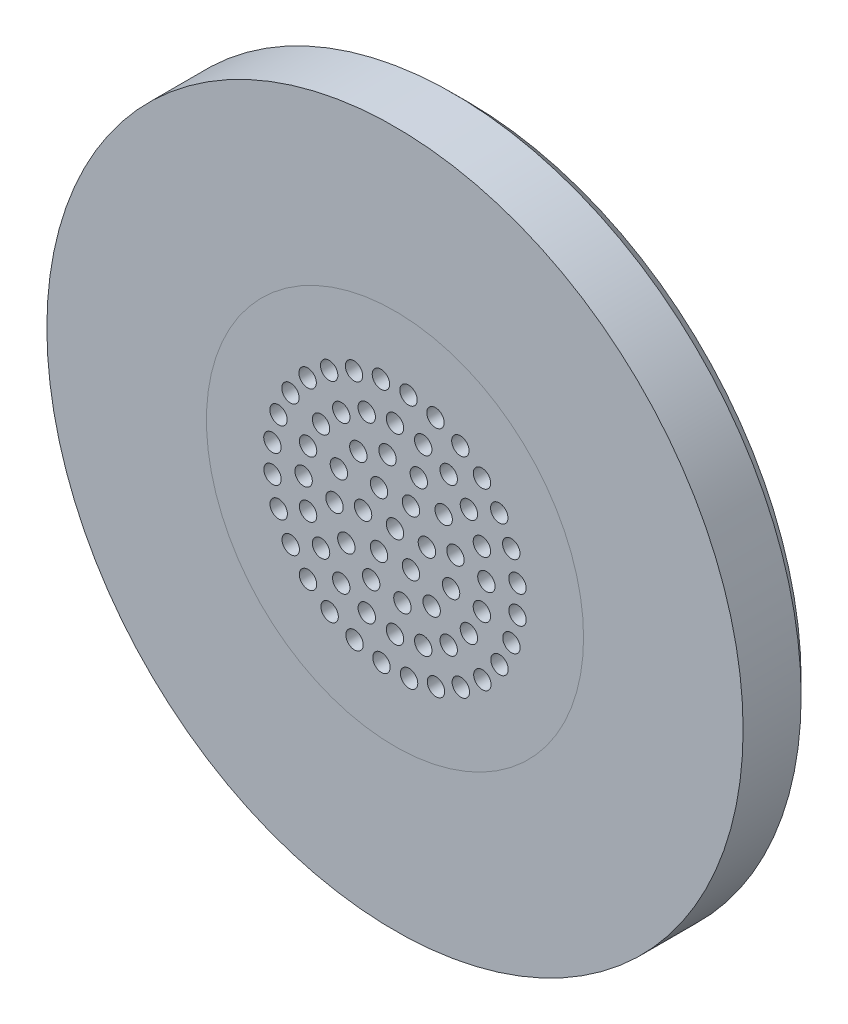
from build123d import *

# Parameters (mm, degrees)
SCHIZZO1_R                   = 24
SCHIZZO1_R_2                 = 0.6
ESTRUSIONE_ESTRUSIONE1_DEPTH = 5
SMUSSO1_SIZE                 = 1


with BuildPart() as part:
    # Schizzo1 → Estrusione-Estrusione1 (new body)
    with BuildSketch(Plane.XY):
        Circle(SCHIZZO1_R)
        with Locations((-2.2, 0)):
            Circle(SCHIZZO1_R_2, mode=Mode.SUBTRACT)
        Circle(SCHIZZO1_R_2, mode=Mode.SUBTRACT)
        with Locations((-3.866120385, 1.64107074)):
            Circle(SCHIZZO1_R_2, mode=Mode.SUBTRACT)
        with Locations((-1.1, 1.905255888)):
            Circle(SCHIZZO1_R_2, mode=Mode.SUBTRACT)
        with Locations((1.1, 1.905255888)):
            Circle(SCHIZZO1_R_2, mode=Mode.SUBTRACT)
        with Locations((2.2, 0)):
            Circle(SCHIZZO1_R_2, mode=Mode.SUBTRACT)
        with Locations((1.1, -1.905255888)):
            Circle(SCHIZZO1_R_2, mode=Mode.SUBTRACT)
        with Locations((-1.1, -1.905255888)):
            Circle(SCHIZZO1_R_2, mode=Mode.SUBTRACT)
        with Locations((-2.527623097, 3.354269142)):
            Circle(SCHIZZO1_R_2, mode=Mode.SUBTRACT)
        with Locations((-0.511851242, 4.168693837)):
            Circle(SCHIZZO1_R_2, mode=Mode.SUBTRACT)
        with Locations((1.64107074, 3.866120385)):
            Circle(SCHIZZO1_R_2, mode=Mode.SUBTRACT)
        with Locations((3.354269142, 2.527623097)):
            Circle(SCHIZZO1_R_2, mode=Mode.SUBTRACT)
        with Locations((4.168693837, 0.511851242)):
            Circle(SCHIZZO1_R_2, mode=Mode.SUBTRACT)
        with Locations((3.866120385, -1.64107074)):
            Circle(SCHIZZO1_R_2, mode=Mode.SUBTRACT)
        with Locations((2.527623097, -3.354269142)):
            Circle(SCHIZZO1_R_2, mode=Mode.SUBTRACT)
        with Locations((0.511851242, -4.168693837)):
            Circle(SCHIZZO1_R_2, mode=Mode.SUBTRACT)
        with Locations((-1.64107074, -3.866120385)):
            Circle(SCHIZZO1_R_2, mode=Mode.SUBTRACT)
        with Locations((-3.354269142, -2.527623097)):
            Circle(SCHIZZO1_R_2, mode=Mode.SUBTRACT)
        with Locations((-4.168693837, -0.511851242)):
            Circle(SCHIZZO1_R_2, mode=Mode.SUBTRACT)
        with Locations((-6.3, 0)):
            Circle(SCHIZZO1_R_2, mode=Mode.SUBTRACT)
        with Locations((-5.991656053, 1.946807065)):
            Circle(SCHIZZO1_R_2, mode=Mode.SUBTRACT)
        with Locations((-5.096807065, 3.703047089)):
            Circle(SCHIZZO1_R_2, mode=Mode.SUBTRACT)
        with Locations((-3.703047089, 5.096807065)):
            Circle(SCHIZZO1_R_2, mode=Mode.SUBTRACT)
        with Locations((-1.946807065, 5.991656053)):
            Circle(SCHIZZO1_R_2, mode=Mode.SUBTRACT)
        with Locations((0, 6.3)):
            Circle(SCHIZZO1_R_2, mode=Mode.SUBTRACT)
        with Locations((1.946807065, 5.991656053)):
            Circle(SCHIZZO1_R_2, mode=Mode.SUBTRACT)
        with Locations((3.703047089, 5.096807065)):
            Circle(SCHIZZO1_R_2, mode=Mode.SUBTRACT)
        with Locations((5.096807065, 3.703047089)):
            Circle(SCHIZZO1_R_2, mode=Mode.SUBTRACT)
        with Locations((5.991656053, 1.946807065)):
            Circle(SCHIZZO1_R_2, mode=Mode.SUBTRACT)
        with Locations((6.3, 0)):
            Circle(SCHIZZO1_R_2, mode=Mode.SUBTRACT)
        with Locations((5.991656053, -1.946807065)):
            Circle(SCHIZZO1_R_2, mode=Mode.SUBTRACT)
        with Locations((5.096807065, -3.703047089)):
            Circle(SCHIZZO1_R_2, mode=Mode.SUBTRACT)
        with Locations((3.703047089, -5.096807065)):
            Circle(SCHIZZO1_R_2, mode=Mode.SUBTRACT)
        with Locations((1.946807065, -5.991656053)):
            Circle(SCHIZZO1_R_2, mode=Mode.SUBTRACT)
        with Locations((0, -6.3)):
            Circle(SCHIZZO1_R_2, mode=Mode.SUBTRACT)
        with Locations((-1.946807065, -5.991656053)):
            Circle(SCHIZZO1_R_2, mode=Mode.SUBTRACT)
        with Locations((-3.703047089, -5.096807065)):
            Circle(SCHIZZO1_R_2, mode=Mode.SUBTRACT)
        with Locations((-5.096807065, -3.703047089)):
            Circle(SCHIZZO1_R_2, mode=Mode.SUBTRACT)
        with Locations((-5.991656053, -1.946807065)):
            Circle(SCHIZZO1_R_2, mode=Mode.SUBTRACT)
        with Locations((-8.448689608, 0.932547001)):
            Circle(SCHIZZO1_R_2, mode=Mode.SUBTRACT)
        with Locations((-8.02935209, 2.789176403)):
            Circle(SCHIZZO1_R_2, mode=Mode.SUBTRACT)
        with Locations((-7.207389331, 4.505944854)):
            Circle(SCHIZZO1_R_2, mode=Mode.SUBTRACT)
        with Locations((-6.024017976, 5.996766414)):
            Circle(SCHIZZO1_R_2, mode=Mode.SUBTRACT)
        with Locations((-4.538577205, 7.186885066)):
            Circle(SCHIZZO1_R_2, mode=Mode.SUBTRACT)
        with Locations((-2.825553222, 8.016623291)):
            Circle(SCHIZZO1_R_2, mode=Mode.SUBTRACT)
        with Locations((-0.970844201, 8.44437455)):
            Circle(SCHIZZO1_R_2, mode=Mode.SUBTRACT)
        with Locations((0.932547001, 8.448689608)):
            Circle(SCHIZZO1_R_2, mode=Mode.SUBTRACT)
        with Locations((2.789176403, 8.02935209)):
            Circle(SCHIZZO1_R_2, mode=Mode.SUBTRACT)
        with Locations((4.505944854, 7.207389331)):
            Circle(SCHIZZO1_R_2, mode=Mode.SUBTRACT)
        with Locations((5.996766414, 6.024017976)):
            Circle(SCHIZZO1_R_2, mode=Mode.SUBTRACT)
        with Locations((7.186885066, 4.538577205)):
            Circle(SCHIZZO1_R_2, mode=Mode.SUBTRACT)
        with Locations((8.016623291, 2.825553222)):
            Circle(SCHIZZO1_R_2, mode=Mode.SUBTRACT)
        with Locations((8.44437455, 0.970844201)):
            Circle(SCHIZZO1_R_2, mode=Mode.SUBTRACT)
        with Locations((8.448689608, -0.932547001)):
            Circle(SCHIZZO1_R_2, mode=Mode.SUBTRACT)
        with Locations((8.02935209, -2.789176403)):
            Circle(SCHIZZO1_R_2, mode=Mode.SUBTRACT)
        with Locations((7.207389331, -4.505944854)):
            Circle(SCHIZZO1_R_2, mode=Mode.SUBTRACT)
        with Locations((6.024017976, -5.996766414)):
            Circle(SCHIZZO1_R_2, mode=Mode.SUBTRACT)
        with Locations((4.538577205, -7.186885066)):
            Circle(SCHIZZO1_R_2, mode=Mode.SUBTRACT)
        with Locations((2.825553222, -8.016623291)):
            Circle(SCHIZZO1_R_2, mode=Mode.SUBTRACT)
        with Locations((0.970844201, -8.44437455)):
            Circle(SCHIZZO1_R_2, mode=Mode.SUBTRACT)
        with Locations((-0.932547001, -8.448689608)):
            Circle(SCHIZZO1_R_2, mode=Mode.SUBTRACT)
        with Locations((-2.789176403, -8.02935209)):
            Circle(SCHIZZO1_R_2, mode=Mode.SUBTRACT)
        with Locations((-4.505944854, -7.207389331)):
            Circle(SCHIZZO1_R_2, mode=Mode.SUBTRACT)
        with Locations((-5.996766414, -6.024017976)):
            Circle(SCHIZZO1_R_2, mode=Mode.SUBTRACT)
        with Locations((-7.186885066, -4.538577205)):
            Circle(SCHIZZO1_R_2, mode=Mode.SUBTRACT)
        with Locations((-8.016623291, -2.825553222)):
            Circle(SCHIZZO1_R_2, mode=Mode.SUBTRACT)
        with Locations((-8.44437455, -0.970844201)):
            Circle(SCHIZZO1_R_2, mode=Mode.SUBTRACT)
    extrude(amount=ESTRUSIONE_ESTRUSIONE1_DEPTH)

    # Smusso1
    smusso1_edges = [part.edges().sort_by_distance(p)[0] for p in [
        (-24, 0, 0),
    ]]
    chamfer(smusso1_edges, length=SMUSSO1_SIZE)


solid = part.part
